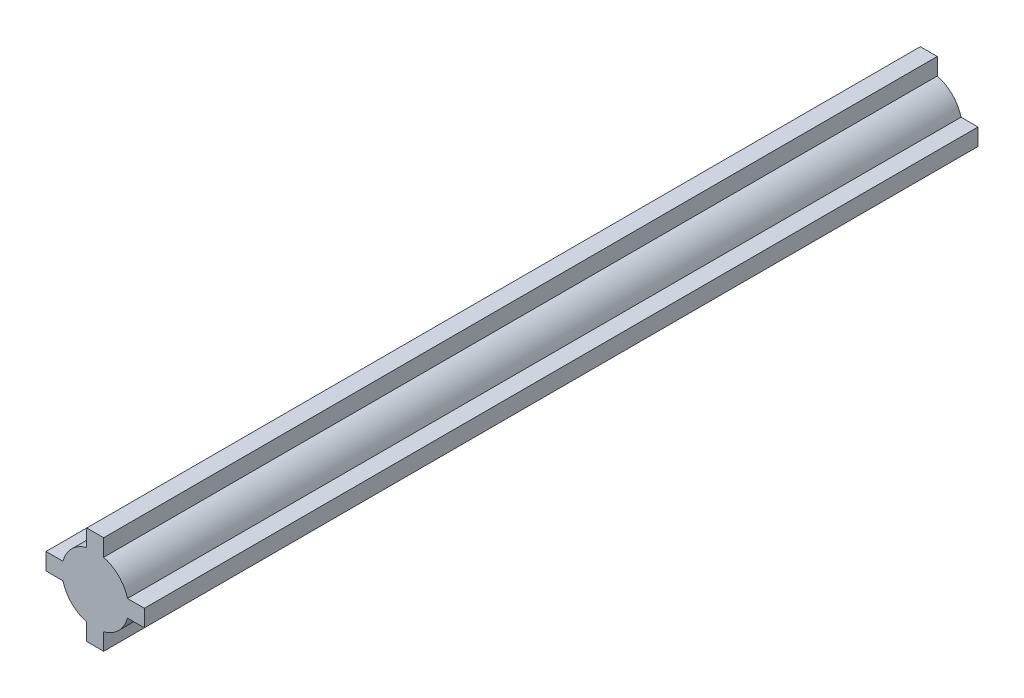
from build123d import *

# Parameters (mm, degrees)
BOSS_EXTRUDE1_DEPTH = 12.5


with BuildPart() as part:
    # Sketch1 → Boss-Extrude1 (new, symmetric)
    with BuildSketch(Plane.XY):
        with BuildLine():
            Line((-0.254, 1.475204218), (-0.254, 0.967204218))
            ThreePointArc((-0.254, 0.967204218), (-0.707106781, 0.707106781), (-0.967204218, 0.254))
            Line((-0.967204218, 0.254), (-1.475204218, 0.254))
            Line((-1.475204218, 0.254), (-1.475204218, -0.254))
            Line((-1.475204218, -0.254), (-0.967204218, -0.254))
            ThreePointArc((-0.967204218, -0.254), (-0.707106781, -0.707106781), (-0.254, -0.967204218))
            Line((-0.254, -0.967204218), (-0.254, -1.475204218))
            Line((-0.254, -1.475204218), (0.254, -1.475204218))
            Line((0.254, -1.475204218), (0.254, -0.967204218))
            ThreePointArc((0.254, -0.967204218), (0.707106781, -0.707106781), (0.967204218, -0.254))
            Line((0.967204218, -0.254), (1.475204218, -0.254))
            Line((1.475204218, -0.254), (1.475204218, 0.254))
            Line((1.475204218, 0.254), (0.967204218, 0.254))
            ThreePointArc((0.967204218, 0.254), (0.707106781, 0.707106781), (0.254, 0.967204218))
            Line((0.254, 0.967204218), (0.254, 1.475204218))
            Line((0.254, 1.475204218), (-0.254, 1.475204218))
        make_face()
    extrude(amount=BOSS_EXTRUDE1_DEPTH, both=True)


solid = part.part
